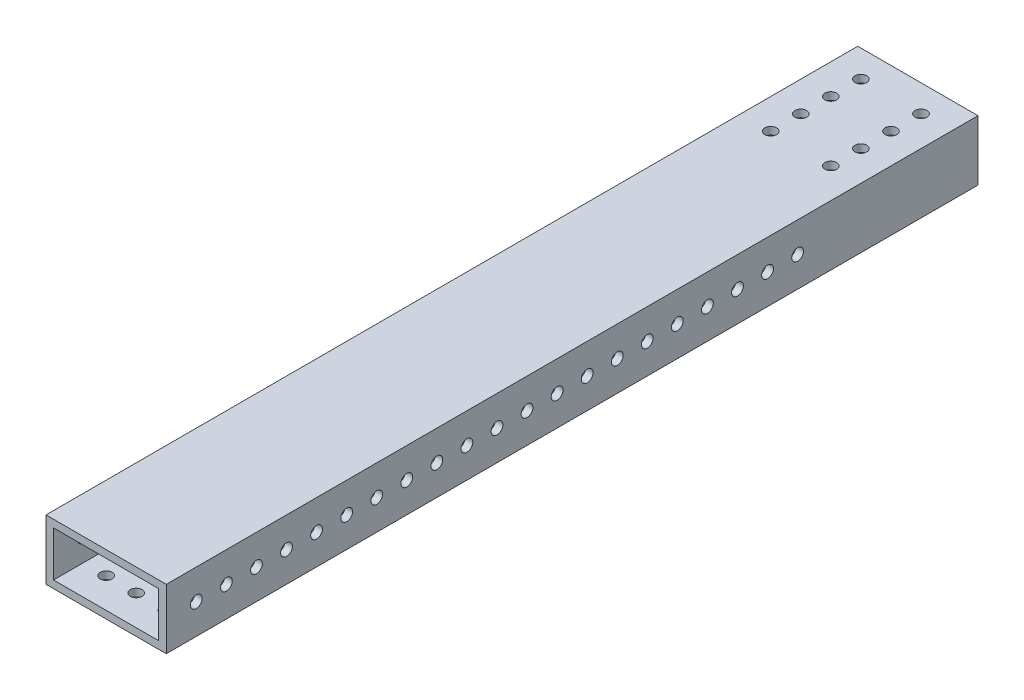
from build123d import *

# Parameters (mm, degrees)
SKETCH1_W           = 50.8
SKETCH1_H           = 342.9
BOSS_EXTRUDE1_DEPTH = 25.4
SHELL1_T            = -3.175
SKETCH2_R           = 2.4892
CUT_EXTRUDE1_DEPTH  = 348.571877458
SKETCH3_R           = 2.4892
CUT_EXTRUDE2_DEPTH  = 348.571877458
CUT_EXTRUDE3_REACH  = 349.572
SKETCH3_3_R         = 2.4892


with BuildPart() as part:
    # Sketch1 → Boss-Extrude1 (new body)
    with BuildSketch(Plane(origin=(0, 0, 0), x_dir=(1, 0, 0), z_dir=(0, 1, 0))):
        with Locations((25.4, 171.45)):
            Rectangle(SKETCH1_W, SKETCH1_H)
    extrude(amount=BOSS_EXTRUDE1_DEPTH)

    # Shell1
    shell1_openings = [part.faces().sort_by_distance(p)[0] for p in [
        (25.4, 12.7, -342.9),
        (25.4, 12.7, 0),
    ]]
    offset(amount=SHELL1_T, openings=shell1_openings, kind=Kind.INTERSECTION)

    # Sketch2 → Cut-Extrude1 (cut, through all)
    with BuildSketch(Plane.ZY):
        with Locations((-12.7, 12.7)):
            Circle(SKETCH2_R)
        with Locations((-25.4, 12.7)):
            Circle(SKETCH2_R)
        with Locations((-38.1, 12.7)):
            Circle(SKETCH2_R)
        with Locations((-50.8, 12.7)):
            Circle(SKETCH2_R)
        with Locations((-63.5, 12.7)):
            Circle(SKETCH2_R)
        with Locations((-76.2, 12.7)):
            Circle(SKETCH2_R)
        with Locations((-88.9, 12.7)):
            Circle(SKETCH2_R)
        with Locations((-101.6, 12.7)):
            Circle(SKETCH2_R)
        with Locations((-114.3, 12.7)):
            Circle(SKETCH2_R)
        with Locations((-127, 12.7)):
            Circle(SKETCH2_R)
        with Locations((-139.7, 12.7)):
            Circle(SKETCH2_R)
        with Locations((-152.4, 12.7)):
            Circle(SKETCH2_R)
        with Locations((-165.1, 12.7)):
            Circle(SKETCH2_R)
        with Locations((-177.8, 12.7)):
            Circle(SKETCH2_R)
        with Locations((-190.5, 12.7)):
            Circle(SKETCH2_R)
        with Locations((-203.2, 12.7)):
            Circle(SKETCH2_R)
        with Locations((-215.9, 12.7)):
            Circle(SKETCH2_R)
        with Locations((-228.6, 12.7)):
            Circle(SKETCH2_R)
        with Locations((-241.3, 12.7)):
            Circle(SKETCH2_R)
        with Locations((-254, 12.7)):
            Circle(SKETCH2_R)
        with Locations((-266.7, 12.7)):
            Circle(SKETCH2_R)
    extrude(amount=-CUT_EXTRUDE1_DEPTH, mode=Mode.SUBTRACT)

    # Sketch3 → Cut-Extrude2 (cut, through all)
    with BuildSketch(Plane(origin=(0, 0, 0), x_dir=(1, 0, 0), z_dir=(0, 1, 0))):
        with Locations((12.7, 293.424634479)):
            Circle(SKETCH3_R)
        with Locations((38.1, 293.424634479)):
            Circle(SKETCH3_R)
        with Locations((38.1, 306.124634479)):
            Circle(SKETCH3_R)
        with Locations((12.7, 306.124634479)):
            Circle(SKETCH3_R)
        with Locations((12.7, 318.824634479)):
            Circle(SKETCH3_R)
        with Locations((38.1, 318.824634479)):
            Circle(SKETCH3_R)
        with Locations((38.1, 331.524634479)):
            Circle(SKETCH3_R)
        with Locations((12.7, 331.524634479)):
            Circle(SKETCH3_R)
    extrude(amount=CUT_EXTRUDE2_DEPTH, mode=Mode.SUBTRACT)

    # Sketch3<3> → Cut-Extrude3 (cut, up to next)
    with BuildSketch(Plane(origin=(0, 0, 0), x_dir=(1, 0, 0), z_dir=(0, 1, 0)), mode=Mode.PRIVATE) as cut_extrude3_sk1:
        with Locations((38.1, 63.5)):
            Circle(SKETCH3_3_R)
    cut_extrude3_tool1 = extrude(cut_extrude3_sk1.sketch, amount=CUT_EXTRUDE3_REACH, mode=Mode.PRIVATE) & part.part
    # Sketch3<3> → Cut-Extrude3 (cut, up to next)
    with BuildSketch(Plane(origin=(0, 0, 0), x_dir=(1, 0, 0), z_dir=(0, 1, 0)), mode=Mode.PRIVATE) as cut_extrude3_sk2:
        with Locations((25.4, 63.5)):
            Circle(SKETCH3_3_R)
    cut_extrude3_tool2 = extrude(cut_extrude3_sk2.sketch, amount=CUT_EXTRUDE3_REACH, mode=Mode.PRIVATE) & part.part
    # Sketch3<3> → Cut-Extrude3 (cut, up to next)
    with BuildSketch(Plane(origin=(0, 0, 0), x_dir=(1, 0, 0), z_dir=(0, 1, 0)), mode=Mode.PRIVATE) as cut_extrude3_sk3:
        with Locations((12.7, 63.5)):
            Circle(SKETCH3_3_R)
    cut_extrude3_tool3 = extrude(cut_extrude3_sk3.sketch, amount=CUT_EXTRUDE3_REACH, mode=Mode.PRIVATE) & part.part
    # Sketch3<3> → Cut-Extrude3 (cut, up to next)
    with BuildSketch(Plane(origin=(0, 0, 0), x_dir=(1, 0, 0), z_dir=(0, 1, 0)), mode=Mode.PRIVATE) as cut_extrude3_sk4:
        with Locations((12.7, 50.8)):
            Circle(SKETCH3_3_R)
    cut_extrude3_tool4 = extrude(cut_extrude3_sk4.sketch, amount=CUT_EXTRUDE3_REACH, mode=Mode.PRIVATE) & part.part
    # Sketch3<3> → Cut-Extrude3 (cut, up to next)
    with BuildSketch(Plane(origin=(0, 0, 0), x_dir=(1, 0, 0), z_dir=(0, 1, 0)), mode=Mode.PRIVATE) as cut_extrude3_sk5:
        with Locations((25.4, 50.8)):
            Circle(SKETCH3_3_R)
    cut_extrude3_tool5 = extrude(cut_extrude3_sk5.sketch, amount=CUT_EXTRUDE3_REACH, mode=Mode.PRIVATE) & part.part
    # Sketch3<3> → Cut-Extrude3 (cut, up to next)
    with BuildSketch(Plane(origin=(0, 0, 0), x_dir=(1, 0, 0), z_dir=(0, 1, 0)), mode=Mode.PRIVATE) as cut_extrude3_sk6:
        with Locations((38.1, 50.8)):
            Circle(SKETCH3_3_R)
    cut_extrude3_tool6 = extrude(cut_extrude3_sk6.sketch, amount=CUT_EXTRUDE3_REACH, mode=Mode.PRIVATE) & part.part
    # Sketch3<3> → Cut-Extrude3 (cut, up to next)
    with BuildSketch(Plane(origin=(0, 0, 0), x_dir=(1, 0, 0), z_dir=(0, 1, 0)), mode=Mode.PRIVATE) as cut_extrude3_sk7:
        with Locations((12.7, 38.1)):
            Circle(SKETCH3_3_R)
    cut_extrude3_tool7 = extrude(cut_extrude3_sk7.sketch, amount=CUT_EXTRUDE3_REACH, mode=Mode.PRIVATE) & part.part
    # Sketch3<3> → Cut-Extrude3 (cut, up to next)
    with BuildSketch(Plane(origin=(0, 0, 0), x_dir=(1, 0, 0), z_dir=(0, 1, 0)), mode=Mode.PRIVATE) as cut_extrude3_sk8:
        with Locations((25.4, 38.1)):
            Circle(SKETCH3_3_R)
    cut_extrude3_tool8 = extrude(cut_extrude3_sk8.sketch, amount=CUT_EXTRUDE3_REACH, mode=Mode.PRIVATE) & part.part
    # Sketch3<3> → Cut-Extrude3 (cut, up to next)
    with BuildSketch(Plane(origin=(0, 0, 0), x_dir=(1, 0, 0), z_dir=(0, 1, 0)), mode=Mode.PRIVATE) as cut_extrude3_sk9:
        with Locations((38.1, 38.1)):
            Circle(SKETCH3_3_R)
    cut_extrude3_tool9 = extrude(cut_extrude3_sk9.sketch, amount=CUT_EXTRUDE3_REACH, mode=Mode.PRIVATE) & part.part
    # Sketch3<3> → Cut-Extrude3 (cut, up to next)
    with BuildSketch(Plane(origin=(0, 0, 0), x_dir=(1, 0, 0), z_dir=(0, 1, 0)), mode=Mode.PRIVATE) as cut_extrude3_sk10:
        with Locations((38.1, 25.4)):
            Circle(SKETCH3_3_R)
    cut_extrude3_tool10 = extrude(cut_extrude3_sk10.sketch, amount=CUT_EXTRUDE3_REACH, mode=Mode.PRIVATE) & part.part
    # Sketch3<3> → Cut-Extrude3 (cut, up to next)
    with BuildSketch(Plane(origin=(0, 0, 0), x_dir=(1, 0, 0), z_dir=(0, 1, 0)), mode=Mode.PRIVATE) as cut_extrude3_sk11:
        with Locations((25.4, 25.4)):
            Circle(SKETCH3_3_R)
    cut_extrude3_tool11 = extrude(cut_extrude3_sk11.sketch, amount=CUT_EXTRUDE3_REACH, mode=Mode.PRIVATE) & part.part
    # Sketch3<3> → Cut-Extrude3 (cut, up to next)
    with BuildSketch(Plane(origin=(0, 0, 0), x_dir=(1, 0, 0), z_dir=(0, 1, 0)), mode=Mode.PRIVATE) as cut_extrude3_sk12:
        with Locations((12.7, 25.4)):
            Circle(SKETCH3_3_R)
    cut_extrude3_tool12 = extrude(cut_extrude3_sk12.sketch, amount=CUT_EXTRUDE3_REACH, mode=Mode.PRIVATE) & part.part
    # Sketch3<3> → Cut-Extrude3 (cut, up to next)
    with BuildSketch(Plane(origin=(0, 0, 0), x_dir=(1, 0, 0), z_dir=(0, 1, 0)), mode=Mode.PRIVATE) as cut_extrude3_sk13:
        with Locations((12.7, 12.7)):
            Circle(SKETCH3_3_R)
    cut_extrude3_tool13 = extrude(cut_extrude3_sk13.sketch, amount=CUT_EXTRUDE3_REACH, mode=Mode.PRIVATE) & part.part
    # Sketch3<3> → Cut-Extrude3 (cut, up to next)
    with BuildSketch(Plane(origin=(0, 0, 0), x_dir=(1, 0, 0), z_dir=(0, 1, 0)), mode=Mode.PRIVATE) as cut_extrude3_sk14:
        with Locations((25.4, 12.7)):
            Circle(SKETCH3_3_R)
    cut_extrude3_tool14 = extrude(cut_extrude3_sk14.sketch, amount=CUT_EXTRUDE3_REACH, mode=Mode.PRIVATE) & part.part
    # Sketch3<3> → Cut-Extrude3 (cut, up to next)
    with BuildSketch(Plane(origin=(0, 0, 0), x_dir=(1, 0, 0), z_dir=(0, 1, 0)), mode=Mode.PRIVATE) as cut_extrude3_sk15:
        with Locations((38.1, 12.7)):
            Circle(SKETCH3_3_R)
    cut_extrude3_tool15 = extrude(cut_extrude3_sk15.sketch, amount=CUT_EXTRUDE3_REACH, mode=Mode.PRIVATE) & part.part
    add(cut_extrude3_tool1.solids().sort_by_distance((38.1, 0, -63.5))[0], mode=Mode.SUBTRACT)
    add(cut_extrude3_tool2.solids().sort_by_distance((25.4, 0, -63.5))[0], mode=Mode.SUBTRACT)
    add(cut_extrude3_tool3.solids().sort_by_distance((12.7, 0, -63.5))[0], mode=Mode.SUBTRACT)
    add(cut_extrude3_tool4.solids().sort_by_distance((12.7, 0, -50.8))[0], mode=Mode.SUBTRACT)
    add(cut_extrude3_tool5.solids().sort_by_distance((25.4, 0, -50.8))[0], mode=Mode.SUBTRACT)
    add(cut_extrude3_tool6.solids().sort_by_distance((38.1, 0, -50.8))[0], mode=Mode.SUBTRACT)
    add(cut_extrude3_tool7.solids().sort_by_distance((12.7, 0, -38.1))[0], mode=Mode.SUBTRACT)
    add(cut_extrude3_tool8.solids().sort_by_distance((25.4, 0, -38.1))[0], mode=Mode.SUBTRACT)
    add(cut_extrude3_tool9.solids().sort_by_distance((38.1, 0, -38.1))[0], mode=Mode.SUBTRACT)
    add(cut_extrude3_tool10.solids().sort_by_distance((38.1, 0, -25.4))[0], mode=Mode.SUBTRACT)
    add(cut_extrude3_tool11.solids().sort_by_distance((25.4, 0, -25.4))[0], mode=Mode.SUBTRACT)
    add(cut_extrude3_tool12.solids().sort_by_distance((12.7, 0, -25.4))[0], mode=Mode.SUBTRACT)
    add(cut_extrude3_tool13.solids().sort_by_distance((12.7, 0, -12.7))[0], mode=Mode.SUBTRACT)
    add(cut_extrude3_tool14.solids().sort_by_distance((25.4, 0, -12.7))[0], mode=Mode.SUBTRACT)
    add(cut_extrude3_tool15.solids().sort_by_distance((38.1, 0, -12.7))[0], mode=Mode.SUBTRACT)


solid = part.part
